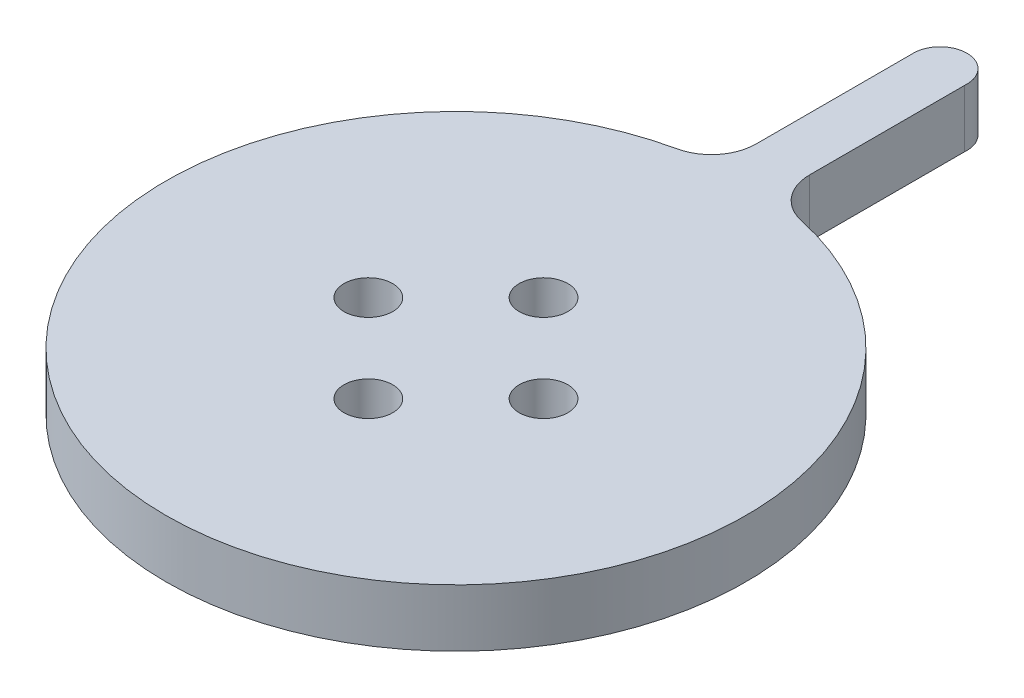
from build123d import *

# Parameters (mm, degrees)
SKETCH2_R           = 32.76798012
BOSS_EXTRUDE1_DEPTH = 5
BOSS_EXTRUDE2_START = 1.5
SKETCH3_R           = 32.76798012
SKETCH3_R_2         = 30.26798012
BOSS_EXTRUDE2_DEPTH = 1.5
SKETCH4_R           = 2.75
CUT_EXTRUDE1_DEPTH  = 9.8994949
BOSS_EXTRUDE3_START = -6.5
BOSS_EXTRUDE3_DEPTH = 6.5


with BuildPart() as part:
    # Sketch2 → Boss-Extrude1 (new body)
    with BuildSketch(Plane(origin=(0, 0, 0), x_dir=(1, 0, 0), z_dir=(0, 1, 0))):
        Circle(SKETCH2_R)
    extrude(amount=BOSS_EXTRUDE1_DEPTH)

    # Sketch3 → Boss-Extrude2 (add)
    with BuildSketch(Plane.XZ.offset(BOSS_EXTRUDE2_START)):
        Circle(SKETCH3_R)
        Circle(SKETCH3_R_2, mode=Mode.SUBTRACT)
    extrude(amount=-BOSS_EXTRUDE2_DEPTH)

    # Sketch4 → Cut-Extrude1 (cut)
    with BuildSketch(Plane(origin=(0, 5, 0), x_dir=(1, 0, 0), z_dir=(0, 1, 0))):
        with Locations((0, 9.8994949)):
            Circle(SKETCH4_R)
        with Locations((-9.9, 0)):
            Circle(SKETCH4_R)
        with Locations((9.9, 0)):
            Circle(SKETCH4_R)
        with Locations((0, -9.9)):
            Circle(SKETCH4_R)
    extrude(amount=-CUT_EXTRUDE1_DEPTH, mode=Mode.SUBTRACT)

    # Sketch5 → Boss-Extrude3 (add)
    with BuildSketch(Plane(origin=(0, 5, 0), x_dir=(1, 0, 0), z_dir=(0, 1, 0)).offset(BOSS_EXTRUDE3_START)):
        with BuildLine():
            Line((-3.023415672, 36.951680319), (-3.023415672, 54.951680319))
            ThreePointArc((-3.023415672, 54.951680319), (0.237235199, 57.737860793), (3.023415672, 54.477209922))
            Line((3.023415672, 54.477209922), (3.023415672, 36.951680319))
            ThreePointArc((3.023415672, 36.951680319), (4.141073493, 33.780800032), (7, 32.011568552))
            ThreePointArc((7, 32.011568552), (0, 32.76798012), (-7, 32.011568552))
            ThreePointArc((-7, 32.011568552), (-4.141073493, 33.780800032), (-3.023415672, 36.951680319))
        make_face()
    extrude(amount=BOSS_EXTRUDE3_DEPTH)


solid = part.part
